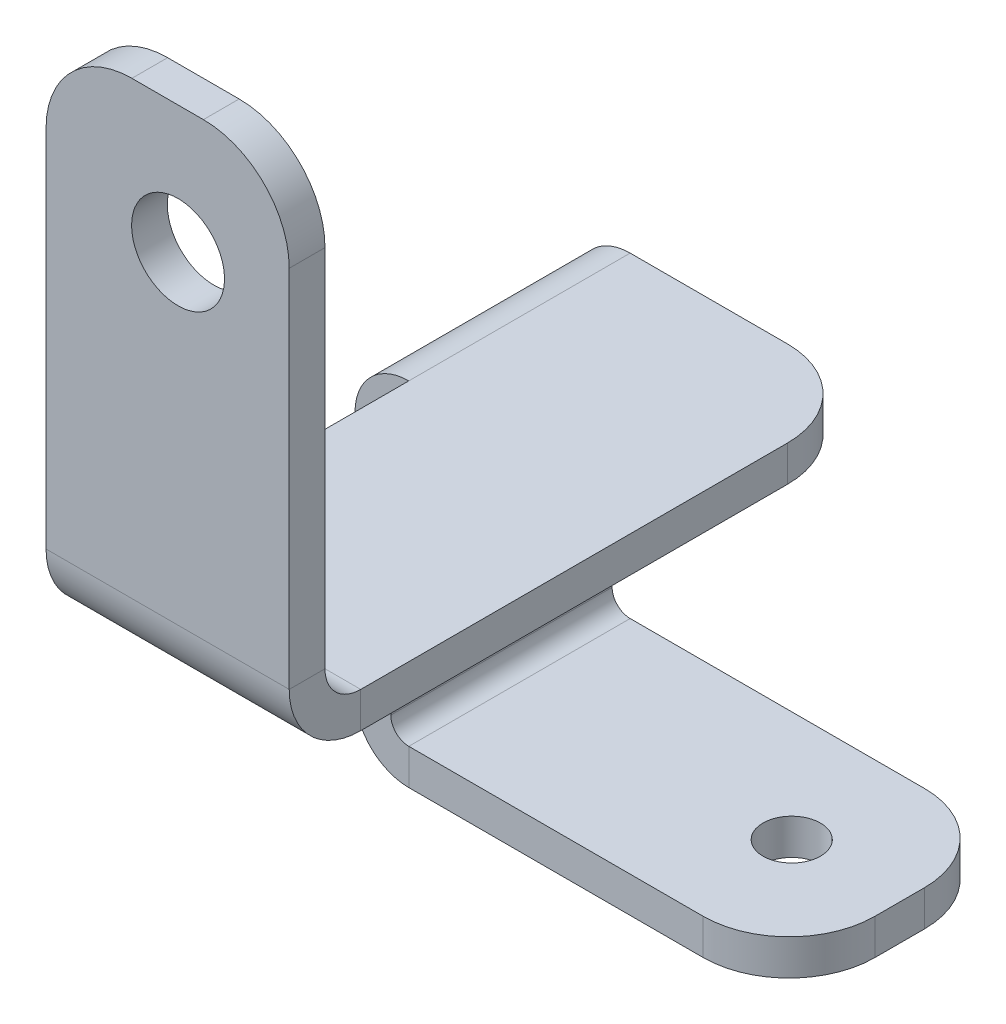
from build123d import *

# Parameters (mm, degrees)
SKETCH1_W                    = 21.59
SKETCH1_H                    = 43.18
SKETCH1_R                    = 4.124999878
BOSS_EXTRUDE1_DEPTH          = 3.175
EDGE_FLANGE1_STRIP_W         = 19.05
EDGE_FLANGE1_STRIP_H         = 3.175
EDGE_FLANGE1_STRIP_CUT_DEPTH = 21.59
EDGE_FLANGE1_DEPTH           = 21.59
EDGE_FLANGE2_DEPTH           = 19.65452
EDGE_FLANGE2_START           = 3.175
EDGE_FLANGE2_FLAT_DEPTH      = 3.175
EDGE_FLANGE3_STRIP_W         = 15.900000204
EDGE_FLANGE3_STRIP_H         = 3.175
EDGE_FLANGE3_STRIP_CUT_DEPTH = 19.65452
EDGE_FLANGE3_DEPTH           = 19.65452
CUT_EXTRUDE2_REACH           = 97.152
SKETCH11_R                   = 2.55
FILLET1_R                    = 7.62


# Sheet-metal steps are written as plain solids
with BuildPart() as part:
    # Sketch1 → Boss-Extrude1 (new body)
    with BuildSketch(Plane.XY):
        with Locations((10.795, 0.048317484)):
            Rectangle(SKETCH1_W, SKETCH1_H)
        with Locations(Location((11.7183, 10.32174739, 0), (0, 0, 180))):
            Circle(SKETCH1_R, mode=Mode.SUBTRACT)
    extrude(amount=BOSS_EXTRUDE1_DEPTH)

    # Edge-Flange1: sheet metal written as solids
    # Edge-Flange1 strip (on a plane across the edge) → Edge-Flange1 strip cut (cut)
    with BuildSketch(Plane(origin=(21.59, -21.541682516, 0), x_dir=(0, 1, 0), z_dir=(-1, 0, 0))):
        with Locations((-6.35, -1.5875)):
            Rectangle(EDGE_FLANGE1_STRIP_W, EDGE_FLANGE1_STRIP_H)
    extrude(amount=EDGE_FLANGE1_STRIP_CUT_DEPTH, mode=Mode.SUBTRACT)

    # Edge-Flange1 section (on a plane across the edge) → Edge-Flange1 (add)
    with BuildSketch(Plane(origin=(21.59, -21.541682516, 0), x_dir=(0, 1, 0), z_dir=(-1, 0, 0))):
        with BuildLine():
            Line((-3.175, 3.175), (-3.175, 48.68672))
            Line((-3.175, 48.68672), (0, 48.68672))
            Line((0, 48.68672), (0, 3.175))
            ThreePointArc((0, 3.175), (0.92993597, 0.92993597), (3.175, 0))
            Line((3.175, 0), (3.175, -3.175))
            ThreePointArc((3.175, -3.175), (-1.315128061, -1.315128061), (-3.175, 3.175))
        make_face()
    extrude(amount=EDGE_FLANGE1_DEPTH)

    # Edge-Flange2: sheet metal written as solids
    # Edge-Flange2 bend section (on a plane across the edge) → Edge-Flange2 (add)
    with BuildSketch(Plane(origin=(-1.600000102, -24.716682516, -29.0322), x_dir=(1, 0, 0), z_dir=(0, 0, -1))):
        with BuildLine():
            Line((-3.175, 1.600000102), (0, 1.600000102))
            ThreePointArc((0, 1.600000102), (0.46862918, 0.46862918), (1.600000102, 0))
            Line((1.600000102, 0), (1.600000102, -3.175))
            ThreePointArc((1.600000102, -3.175), (-1.77643485, -1.77643485), (-3.175, 1.600000102))
        make_face()
    extrude(amount=EDGE_FLANGE2_DEPTH)

    # Edge-Flange2 profile (on flange) → Edge-Flange2 flat (add)
    with BuildSketch(Plane(origin=(-1.600000102, -24.716682516, 0), x_dir=(0, 0, -1), z_dir=(-1, 0, 0)).offset(EDGE_FLANGE2_START)):
        Polygon((29.0322, 28.10002), (29.0322, 19.3675), (29.0322, 1.600000102), (48.68672, 1.600000102), (48.68672, 28.10002), align=None)
    extrude(amount=-EDGE_FLANGE2_FLAT_DEPTH)

    # Edge-Flange3: sheet metal written as solids
    # Edge-Flange3 strip (on a plane across the edge) → Edge-Flange3 strip cut (cut)
    with BuildSketch(Plane(origin=(-1.600000102, -52.816702516, -29.0322), x_dir=(0, 1, 0), z_dir=(0, 0, -1))):
        with Locations((-3.175, -1.5875)):
            Rectangle(EDGE_FLANGE3_STRIP_W, EDGE_FLANGE3_STRIP_H)
    extrude(amount=EDGE_FLANGE3_STRIP_CUT_DEPTH, mode=Mode.SUBTRACT)

    # Edge-Flange3 section (on a plane across the edge) → Edge-Flange3 (add)
    with BuildSketch(Plane(origin=(-1.600000102, -52.816702516, -29.0322), x_dir=(0, 1, 0), z_dir=(0, 0, -1))):
        with BuildLine():
            Line((0, 1.600000102), (0, 35.364220102))
            Line((0, 35.364220102), (3.175, 35.364220102))
            Line((3.175, 35.364220102), (3.175, 1.600000102))
            ThreePointArc((3.175, 1.600000102), (3.64362918, 0.46862918), (4.775000102, 0))
            Line((4.775000102, 0), (4.775000102, -3.175))
            ThreePointArc((4.775000102, -3.175), (1.39856515, -1.77643485), (0, 1.600000102))
        make_face()
    extrude(amount=EDGE_FLANGE3_DEPTH)

    # Sketch11 → Cut-Extrude2 (cut, up to next)
    with BuildSketch(Plane.XZ.offset(52.816702516), mode=Mode.PRIVATE) as cut_extrude2_sk1:
        with Locations((24.17318, -38.85946)):
            Circle(SKETCH11_R)
    cut_extrude2_tool1 = extrude(cut_extrude2_sk1.sketch, amount=-CUT_EXTRUDE2_REACH, mode=Mode.PRIVATE) & part.part
    add(cut_extrude2_tool1.solids().sort_by_distance((24.17318, -52.816703, -38.85946))[0], mode=Mode.SUBTRACT)

    # Fillet1
    fillet1_edges = [part.edges().sort_by_distance(p)[0] for p in [
        (0, 21.638317484, 1.5875),
        (21.59, 21.638317484, 1.5875),
        (21.59, -23.129182516, -48.68672),
        (33.76422, -51.229202516, -29.0322),
        (33.76422, -51.229202516, -48.68672),
    ]]
    fillet(fillet1_edges, radius=FILLET1_R)


solid = part.part
